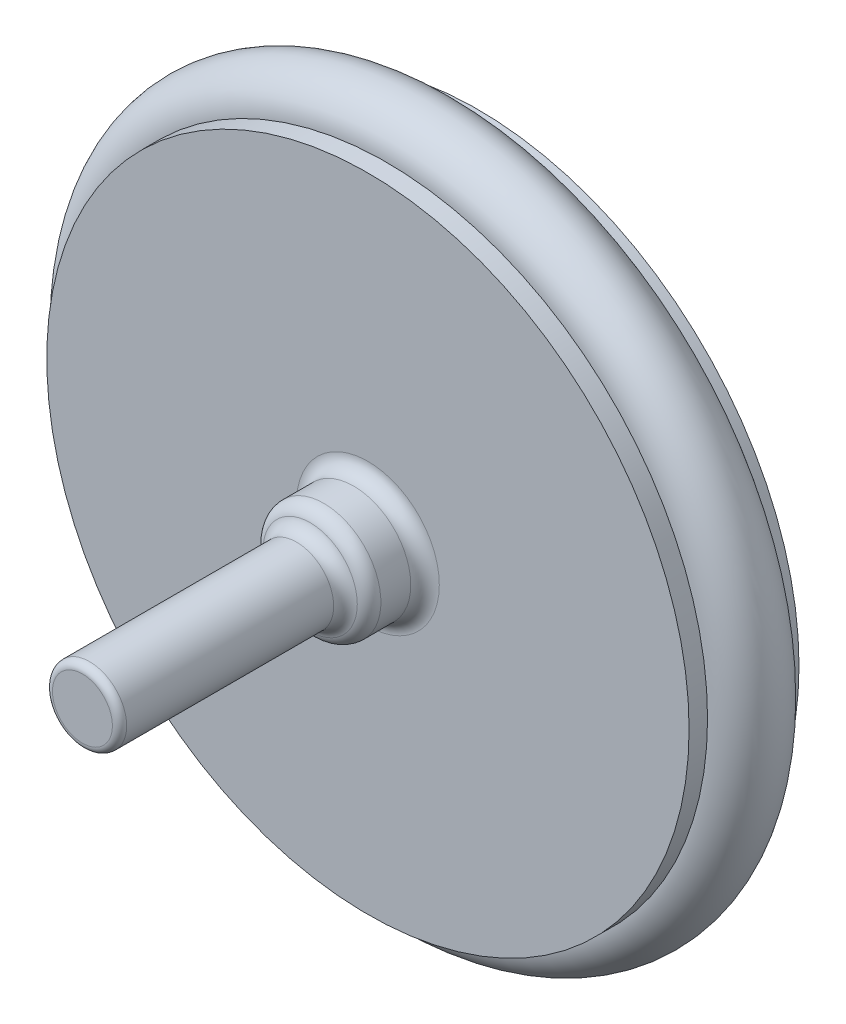
from build123d import *

# Parameters (mm, degrees)
SKETCH1_R           = 22.5
BOSS_EXTRUDE1_DEPTH = 3.85
SWEEP1_OUTLINE_R    = 2.561236926
SKETCH4_R           = 4
BOSS_EXTRUDE2_DEPTH = 4
FILLET1_R           = 1
SKETCH5_R           = 2.6
BOSS_EXTRUDE3_DEPTH = 16
FILLET2_R           = 1
FILLET3_R           = 1
FILLET4_R           = 0.5


# Read off the part's stored shape, not the designer's step: Cut-Sweep1, Sweep1
with BuildPart() as part:
    # Sketch1 → Boss-Extrude1 (new, symmetric)
    with BuildSketch(Plane.XY):
        with Locations(Location((0, 0, 0), (0, 0, 180))):
            Circle(SKETCH1_R)
    extrude(amount=BOSS_EXTRUDE1_DEPTH, both=True)

    # Cut-Sweep1 outline → Cut-Sweep1 (revolve, cut)
    with BuildSketch(Plane.XZ):
        with BuildLine():
            Line((22.5, -2.55), (22.5, 2.55))
            ThreePointArc((22.5, 2.55), (19.95, 0), (22.5, -2.55))
        make_face()
    revolve(axis=Axis((0, 0, 0), (0, 0, 1)), mode=Mode.SUBTRACT)

    # Sketch4 → Boss-Extrude2 (add)
    with BuildSketch(Plane.XY.offset(3.85)):
        Circle(SKETCH4_R)
    extrude(amount=BOSS_EXTRUDE2_DEPTH)

    # Fillet1
    fillet1_edges = [part.edges().sort_by_distance(p)[0] for p in [
        (-4, 0, 3.85),
    ]]
    fillet(fillet1_edges, radius=FILLET1_R)

    # Sketch5 → Boss-Extrude3 (add)
    with BuildSketch(Plane.XY.offset(7.85)):
        Circle(SKETCH5_R)
    extrude(amount=BOSS_EXTRUDE3_DEPTH)

    # Fillet2
    fillet2_edges = [part.edges().sort_by_distance(p)[0] for p in [
        (-2.6, 0, 7.85),
    ]]
    fillet(fillet2_edges, radius=FILLET2_R)

    # Fillet3
    fillet3_edges = [part.edges().sort_by_distance(p)[0] for p in [
        (-4, 0, 7.85),
    ]]
    fillet(fillet3_edges, radius=FILLET3_R)

    # Fillet4
    fillet4_edges = [part.edges().sort_by_distance(p)[0] for p in [
        (-2.6, 0, 23.85),
    ]]
    fillet(fillet4_edges, radius=FILLET4_R)


with BuildPart() as body_2:
    # Sweep1 outline → Sweep1 (revolve)
    with BuildSketch(Plane.XZ):
        with Locations((22.5, 0)):
            Circle(SWEEP1_OUTLINE_R)
    revolve(axis=Axis((0, 0, 0), (0, 0, 1)))


solid = Compound([part.part, body_2.part])
